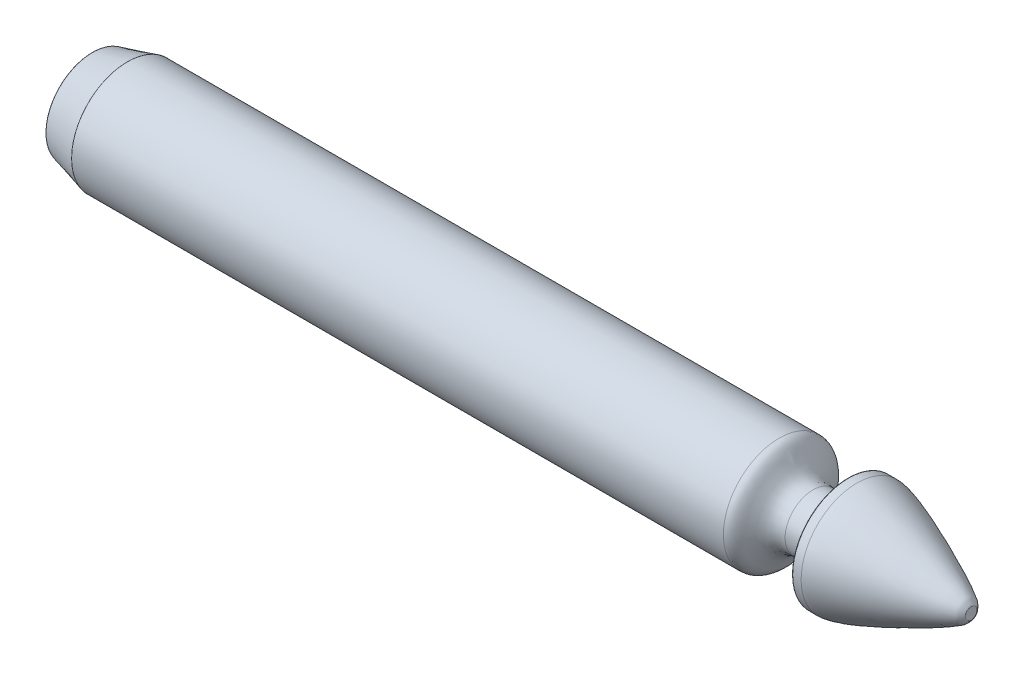
from build123d import *

# Parameters (mm, degrees)
BREAK_EDGES_R = 0.02


with BuildPart() as part:
    # body_sketch → body (revolve)
    with BuildSketch(Plane.XY):
        with BuildLine():
            Line((-16.73571407, 3.175), (-10.921788615, 3.175))
            add(Edge.make_bspline(
                [(-10.921788615, 3.175), (-10.165447426, 3.175), (-10.250040485, 1.5875), (-9, 1.5875)],
                knots=[0, 0, 0, 0, 1, 1, 1, 1], degree=3))
            Line((-9, 1.5875), (-7, 1.5875))
            Line((-7, 1.5875), (-7, 3.175))
            Line((-7, 3.175), (-6.5, 3.175))
            add(Edge.make_bspline(
                [(-6.5, 3.175), (-5.484084378, 3.175), (-0.454332814, 0.896409492), (-0.05462572, 0.424300736), (0, 0.377250903), (0, 0.327812847)],
                knots=[0, 0, 0, 0, 0.586137631, 0.686137631, 1, 1, 1, 1], degree=3))
            Line((0, 0.327812847), (0, 0))
            Line((0, 0), (-50, 0))
            Line((-50, 0), (-50, 2.639101615))
            Line((-50, 2.639101615), (-48, 3.175))
            Line((-48, 3.175), (-20.811079947, 3.175))
            add(Edge.make_bspline(
                [(-20.811079947, 3.175), (-19.383200887, 3.175), (-18.073641119, 3.175), (-16.73571407, 3.175)],
                knots=[0, 0, 0, 0, 1, 1, 1, 1], degree=3))
        make_face()
    revolve(axis=Axis((0, 0, 0), (-1, 0, 0)))

    # break_edges
    break_edges_edges = [part.edges().sort_by_distance(p)[0] for p in [
        (-50, -2.639101615, 0),
        (-48, -3.175, 0),
        (-7, -3.175, 0),
    ]]
    fillet(break_edges_edges, radius=BREAK_EDGES_R)


solid = part.part
